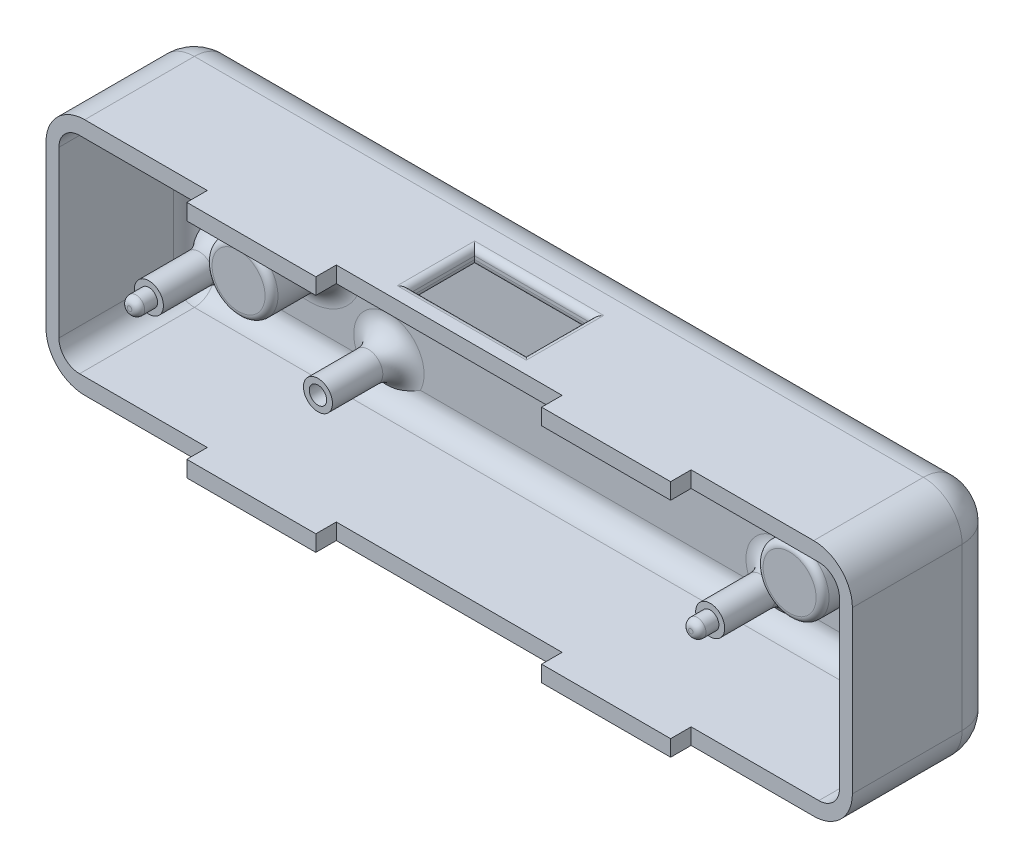
from build123d import *

# Parameters (mm, degrees)
SKETCH1_W           = 125
SKETCH1_H           = 37
BOSS_EXTRUDE1_DEPTH = 2
SKETCH2_W           = 121
SKETCH2_H           = 32
BOSS_EXTRUDE2_DEPTH = 21
SKETCH5_R           = 5.109529215
BOSS_EXTRUDE4_DEPTH = 11
SKETCH6_R           = 1.35
BOSS_EXTRUDE5_DEPTH = 14
SKETCH7_R           = 2.25
BOSS_EXTRUDE6_DEPTH = 11
CUT_EXTRUDE1_REACH  = 78.186
SKETCH9_W           = 18
SKETCH9_H           = 10
CUT_EXTRUDE2_START  = -12
SKETCH10_R          = 1.35
CUT_EXTRUDE2_DEPTH  = 12
FILLET1_R           = 3.2
FILLET2_R           = 1
FILLET3_R           = 6
SKETCH11_W          = 20
SKETCH11_H          = 2.5
BOSS_EXTRUDE7_DEPTH = 3.175


with BuildPart() as part:
    # Sketch1 → Boss-Extrude1 (new body)
    with BuildSketch(Plane.XY):
        Rectangle(SKETCH1_W, SKETCH1_H)
    extrude(amount=BOSS_EXTRUDE1_DEPTH)

    # Sketch2 → Boss-Extrude2 (add)
    with BuildSketch(Plane.XY.offset(2)):
        Polygon((60.5, -18.5), (-60.5, -18.5), (-62.5, -18.5), (-62.5, 18.5), (-60.5, 18.5), (60.5, 18.5), (62.5, 18.5), (62.5, -18.5), align=None)
        Rectangle(SKETCH2_W, SKETCH2_H, mode=Mode.SUBTRACT)
    extrude(amount=BOSS_EXTRUDE2_DEPTH)

    # Sketch5 → Boss-Extrude4 (add)
    with BuildSketch(Plane.XY.offset(2)):
        with Locations(Location((-42.6527, -1.2074, 0), (0, 0, 180))):
            Circle(SKETCH5_R)
        with Locations(Location((42.7653, 1, 0), (0, 0, 180))):
            Circle(SKETCH5_R)
    extrude(amount=BOSS_EXTRUDE4_DEPTH)

    # Sketch6 → Boss-Extrude5 (add)
    with BuildSketch(Plane.XY.offset(2)):
        with Locations(Location((-30.3427, 9.9726, 0), (0, 0, 180))):
            Circle(SKETCH6_R)
        with Locations(Location((-56.5527, 9.9726, 0), (0, 0, 180))):
            Circle(SKETCH6_R)
        with Locations(Location((-56.5527, -10.3874, 0), (0, 0, 180))):
            Circle(SKETCH6_R)
        with Locations(Location((-30.3427, -10.3874, 0), (0, 0, 180))):
            Circle(SKETCH6_R)
        with Locations(Location((56.6653, 10.18, 0), (0, 0, 180))):
            Circle(SKETCH6_R)
        with Locations(Location((30.4553, 10.18, 0), (0, 0, 180))):
            Circle(SKETCH6_R)
        with Locations(Location((30.4553, -10.18, 0), (0, 0, 180))):
            Circle(SKETCH6_R)
        with Locations(Location((56.6653, -10.18, 0), (0, 0, 180))):
            Circle(SKETCH6_R)
    extrude(amount=BOSS_EXTRUDE5_DEPTH)

    # Sketch7 → Boss-Extrude6 (add)
    with BuildSketch(Plane.XY.offset(2)):
        with Locations(Location((56.6653, -10.18, 0), (0, 0, 180))):
            Circle(SKETCH7_R)
        with Locations(Location((30.4553, -10.18, 0), (0, 0, 180))):
            Circle(SKETCH7_R)
        with Locations(Location((30.4553, 10.18, 0), (0, 0, 180))):
            Circle(SKETCH7_R)
        with Locations(Location((56.6653, 10.18, 0), (0, 0, 180))):
            Circle(SKETCH7_R)
        with Locations(Location((-30.3427, 9.9726, 0), (0, 0, 180))):
            Circle(SKETCH7_R)
        with Locations(Location((-30.3427, -10.3874, 0), (0, 0, 180))):
            Circle(SKETCH7_R)
        with Locations(Location((-56.5527, -10.3874, 0), (0, 0, 180))):
            Circle(SKETCH7_R)
        with Locations(Location((-56.5527, 9.9726, 0), (0, 0, 180))):
            Circle(SKETCH7_R)
    extrude(amount=BOSS_EXTRUDE6_DEPTH)

    # Sketch9 → Cut-Extrude1 (cut, up to next)
    with BuildSketch(Plane(origin=(0, 18.5, 0), x_dir=(1, 0, 0), z_dir=(0, 1, 0)), mode=Mode.PRIVATE) as cut_extrude1_sk1:
        with Locations((0, -15.053877106)):
            Rectangle(SKETCH9_W, SKETCH9_H)
    cut_extrude1_tool1 = extrude(cut_extrude1_sk1.sketch, amount=-CUT_EXTRUDE1_REACH, mode=Mode.PRIVATE) & part.part
    add(cut_extrude1_tool1.solids().sort_by_distance((0, 18.5, 15.053877))[0], mode=Mode.SUBTRACT)

    # Sketch10 → Cut-Extrude2 (cut)
    with BuildSketch(Plane.XY.offset(16).offset(CUT_EXTRUDE2_START)):
        with Locations((30.4553, 10.18)):
            Circle(SKETCH10_R)
        with Locations((-30.3427, -10.3874)):
            Circle(SKETCH10_R)
    extrude(amount=CUT_EXTRUDE2_DEPTH, mode=Mode.SUBTRACT)

    # Fillet1
    # the kernel refuses this fillet: 3.2 mm, written as the material it adds along each edge
    with BuildSketch(Plane(origin=(-57.3, -12.8, 5.2), x_dir=(0, -1, 0), z_dir=(-1, 0, 0))) as fillet1_piece_1_section:
        Polygon((0, 0), (FILLET1_R, 0), (FILLET1_R, -FILLET1_R), (0, -FILLET1_R), align=None)
    fillet1_piece_1 = extrude(amount=FILLET1_R, mode=Mode.PRIVATE)
    fillet1_piece_1 = fillet1_piece_1 - Plane(origin=(-57.3, -12.8, 5.2), x_dir=(0, 0.7071067811865475, 0.7071067811865475), z_dir=(-1, 0, 0)) * Sphere(FILLET1_R, mode=Mode.PRIVATE)
    add(fillet1_piece_1)
    with BuildSketch(Plane(origin=(-57.3, 12.8, 5.2), x_dir=(0, 1, 0), z_dir=(-1, 0, 0))) as fillet1_piece_2_section:
        Polygon((0, 0), (FILLET1_R, 0), (FILLET1_R, FILLET1_R), (0, FILLET1_R), align=None)
    fillet1_piece_2 = extrude(amount=FILLET1_R, mode=Mode.PRIVATE)
    fillet1_piece_2 = fillet1_piece_2 - Plane(origin=(-57.3, 12.8, 5.2), x_dir=(0, -0.7071067811865475, 0.7071067811865475), z_dir=(-1, 0, 0)) * Sphere(FILLET1_R, mode=Mode.PRIVATE)
    add(fillet1_piece_2)
    with BuildSketch(Plane(origin=(57.3, -12.8, 5.2), x_dir=(0, -1, 0), z_dir=(1, 0, 0))) as fillet1_piece_3_section:
        Polygon((0, 0), (FILLET1_R, 0), (FILLET1_R, FILLET1_R), (0, FILLET1_R), align=None)
    fillet1_piece_3 = extrude(amount=FILLET1_R, mode=Mode.PRIVATE)
    fillet1_piece_3 = fillet1_piece_3 - Plane(origin=(57.3, -12.8, 5.2), x_dir=(0, 0.7071067811865475, 0.7071067811865475), z_dir=(1, 0, 0)) * Sphere(FILLET1_R, mode=Mode.PRIVATE)
    add(fillet1_piece_3)
    with BuildSketch(Plane(origin=(57.3, 12.8, 5.2), x_dir=(1, 0, 0), z_dir=(0, 1, 0))) as fillet1_piece_4_section:
        Polygon((0, 0), (FILLET1_R, 0), (FILLET1_R, FILLET1_R), (0, FILLET1_R), align=None)
    fillet1_piece_4 = extrude(amount=FILLET1_R, mode=Mode.PRIVATE)
    fillet1_piece_4 = fillet1_piece_4 - Plane(origin=(57.3, 12.8, 5.2), x_dir=(-0.7071067811865475, 0, 0.7071067811865475), z_dir=(0, 1, 0)) * Sphere(FILLET1_R, mode=Mode.PRIVATE)
    add(fillet1_piece_4)
    with BuildSketch(Plane(origin=(-30.3427, 9.9726, 2), x_dir=(-1, 0, 0), z_dir=(0, 1, 0))) as fillet1_piece_5:
        with BuildLine():
            CenterArc((2.25 + FILLET1_R, FILLET1_R), FILLET1_R, 180, 90)
            Line((2.25, FILLET1_R), (2.25, 0))
            Line((2.25, 0), (2.25 + FILLET1_R, 0))
        make_face()
    revolve(axis=Axis((-30.3427, 9.9726, 2), (0, 0, 1)))
    with BuildSketch(Plane(origin=(-30.3427, -10.3874, 2), x_dir=(-1, 0, 0), z_dir=(0, 1, 0))) as fillet1_piece_6:
        with BuildLine():
            CenterArc((2.25 + FILLET1_R, FILLET1_R), FILLET1_R, 180, 90)
            Line((2.25, FILLET1_R), (2.25, 0))
            Line((2.25, 0), (2.25 + FILLET1_R, 0))
        make_face()
    revolve(axis=Axis((-30.3427, -10.3874, 2), (0, 0, 1)))
    with BuildSketch(Plane(origin=(-56.5527, -10.3874, 2), x_dir=(-1, 0, 0), z_dir=(0, 1, 0))) as fillet1_piece_7:
        with BuildLine():
            CenterArc((2.25 + FILLET1_R, FILLET1_R), FILLET1_R, 180, 90)
            Line((2.25, FILLET1_R), (2.25, 0))
            Line((2.25, 0), (2.25 + FILLET1_R, 0))
        make_face()
    revolve(axis=Axis((-56.5527, -10.3874, 2), (0, 0, 1)))
    with BuildSketch(Plane(origin=(-56.5527, 9.9726, 2), x_dir=(-1, 0, 0), z_dir=(0, 1, 0))) as fillet1_piece_8:
        with BuildLine():
            CenterArc((2.25 + FILLET1_R, FILLET1_R), FILLET1_R, 180, 90)
            Line((2.25, FILLET1_R), (2.25, 0))
            Line((2.25, 0), (2.25 + FILLET1_R, 0))
        make_face()
    revolve(axis=Axis((-56.5527, 9.9726, 2), (0, 0, 1)))
    with BuildSketch(Plane(origin=(-60.5, -12.8, 2), x_dir=(1, 0, 0), z_dir=(0, 1, 0))) as fillet1_piece_9:
        with BuildLine():
            CenterArc((FILLET1_R, -FILLET1_R), FILLET1_R, 90, 90)
            Line((0, -FILLET1_R), (0, 0))
            Line((0, 0), (FILLET1_R, 0))
        make_face()
    extrude(amount=25.6)
    with BuildSketch(Plane(origin=(57.3, -16, 2), x_dir=(0, 0, 1), z_dir=(-1, 0, 0)), Plane(origin=(-57.3, 16, 2), x_dir=(0, 0, 1), z_dir=(1, 0, 0))) as fillet1_piece_10:
        with BuildLine():
            CenterArc((FILLET1_R, FILLET1_R), FILLET1_R, 180, 90)
            Line((0, FILLET1_R), (0, 0))
            Line((0, 0), (FILLET1_R, 0))
        make_face()
    extrude(amount=114.6)
    with BuildSketch(Plane(origin=(60.5, 12.8, 2), x_dir=(0, 0, 1), z_dir=(0, -1, 0))) as fillet1_piece_11:
        with BuildLine():
            CenterArc((FILLET1_R, FILLET1_R), FILLET1_R, 180, 90)
            Line((0, FILLET1_R), (0, 0))
            Line((0, 0), (FILLET1_R, 0))
        make_face()
    extrude(amount=25.6)
    with BuildSketch(Plane(origin=(60.5, -16, 5.2), x_dir=(0, 1, 0), z_dir=(0, 0, 1)), Plane(origin=(60.5, 16, 5.2), x_dir=(-1, 0, 0), z_dir=(0, 0, 1)), Plane(origin=(-60.5, -16, 5.2), x_dir=(1, 0, 0), z_dir=(0, 0, 1))) as fillet1_piece_12:
        with BuildLine():
            CenterArc((FILLET1_R, FILLET1_R), FILLET1_R, 180, 90)
            Line((0, FILLET1_R), (0, 0))
            Line((0, 0), (FILLET1_R, 0))
        make_face()
    extrude(amount=17.8)
    with BuildSketch(Plane(origin=(-60.5, 16, 5.2), x_dir=(1, 0, 0), z_dir=(0, 0, 1))) as fillet1_piece_13:
        with BuildLine():
            CenterArc((FILLET1_R, -FILLET1_R), FILLET1_R, 90, 90)
            Line((0, -FILLET1_R), (0, 0))
            Line((0, 0), (FILLET1_R, 0))
        make_face()
    extrude(amount=17.8)
    with BuildSketch(Plane(origin=(-42.6527, -1.2074, 2), x_dir=(-1, 0, 0), z_dir=(0, 1, 0))) as fillet1_piece_14:
        with BuildLine():
            CenterArc((5.109529215 + FILLET1_R, FILLET1_R), FILLET1_R, 180, 90)
            Line((5.109529215, FILLET1_R), (5.109529215, 0))
            Line((5.109529215, 0), (5.109529215 + FILLET1_R, 0))
        make_face()
    revolve(axis=Axis((-42.6527, -1.2074, 2), (0, 0, 1)))
    with BuildSketch(Plane(origin=(42.7653, 1, 2), x_dir=(-1, 0, 0), z_dir=(0, 1, 0))) as fillet1_piece_15:
        with BuildLine():
            CenterArc((5.109529215 + FILLET1_R, FILLET1_R), FILLET1_R, 180, 90)
            Line((5.109529215, FILLET1_R), (5.109529215, 0))
            Line((5.109529215, 0), (5.109529215 + FILLET1_R, 0))
        make_face()
    revolve(axis=Axis((42.7653, 1, 2), (0, 0, 1)))
    with BuildSketch(Plane(origin=(56.6653, -10.18, 2), x_dir=(-1, 0, 0), z_dir=(0, 1, 0))) as fillet1_piece_16:
        with BuildLine():
            CenterArc((2.25 + FILLET1_R, FILLET1_R), FILLET1_R, 180, 90)
            Line((2.25, FILLET1_R), (2.25, 0))
            Line((2.25, 0), (2.25 + FILLET1_R, 0))
        make_face()
    revolve(axis=Axis((56.6653, -10.18, 2), (0, 0, 1)))
    with BuildSketch(Plane(origin=(30.4553, -10.18, 2), x_dir=(-1, 0, 0), z_dir=(0, 1, 0))) as fillet1_piece_17:
        with BuildLine():
            CenterArc((2.25 + FILLET1_R, FILLET1_R), FILLET1_R, 180, 90)
            Line((2.25, FILLET1_R), (2.25, 0))
            Line((2.25, 0), (2.25 + FILLET1_R, 0))
        make_face()
    revolve(axis=Axis((30.4553, -10.18, 2), (0, 0, 1)))
    with BuildSketch(Plane(origin=(30.4553, 10.18, 2), x_dir=(-1, 0, 0), z_dir=(0, 1, 0))) as fillet1_piece_18:
        with BuildLine():
            CenterArc((2.25 + FILLET1_R, FILLET1_R), FILLET1_R, 180, 90)
            Line((2.25, FILLET1_R), (2.25, 0))
            Line((2.25, 0), (2.25 + FILLET1_R, 0))
        make_face()
    revolve(axis=Axis((30.4553, 10.18, 2), (0, 0, 1)))
    with BuildSketch(Plane(origin=(56.6653, 10.18, 2), x_dir=(-1, 0, 0), z_dir=(0, 1, 0))) as fillet1_piece_19:
        with BuildLine():
            CenterArc((2.25 + FILLET1_R, FILLET1_R), FILLET1_R, 180, 90)
            Line((2.25, FILLET1_R), (2.25, 0))
            Line((2.25, 0), (2.25 + FILLET1_R, 0))
        make_face()
    revolve(axis=Axis((56.6653, 10.18, 2), (0, 0, 1)))

    # Fillet2
    fillet2_edges = [part.edges().sort_by_distance(p)[0] for p in [
        (-9, 18.5, 15.053877106),
        (0, 18.5, 20.053877106),
        (9, 18.5, 15.053877106),
        (0, 18.5, 10.053877106),
        (0, 16, 20.053877106),
        (9, 16, 15.053877106),
        (0, 16, 10.053877106),
        (-9, 16, 15.053877106),
        (-37.543170785, -1.2074, 13),
        (47.874829215, 1, 13),
        (-28.9927, 9.9726, 16),
        (-55.2027, 9.9726, 16),
        (-55.2027, -10.3874, 16),
        (58.0153, 10.18, 16),
        (31.8053, -10.18, 16),
        (58.0153, -10.18, 16),
    ]]
    fillet(fillet2_edges, radius=FILLET2_R)

    # Fillet3
    fillet3_edges = [part.edges().sort_by_distance(p)[0] for p in [
        (0, -18.5, 0),
        (62.5, 0, 0),
        (0, 18.5, 0),
        (-62.5, 0, 0),
        (-62.5, -18.5, 11.5),
        (62.5, -18.5, 11.5),
        (62.5, 18.5, 11.5),
        (-62.5, 18.5, 11.5),
    ]]
    fillet(fillet3_edges, radius=FILLET3_R)

    # Sketch11 → Boss-Extrude7 (add)
    with BuildSketch(Plane.XY.offset(23)):
        with Locations((-27.5, 17.25)):
            Rectangle(SKETCH11_W, SKETCH11_H)
        with Locations((-27.5, -17.25)):
            Rectangle(SKETCH11_W, SKETCH11_H)
        with Locations((27.5, 17.25)):
            Rectangle(SKETCH11_W, SKETCH11_H)
        with Locations((27.5, -17.25)):
            Rectangle(SKETCH11_W, SKETCH11_H)
    extrude(amount=BOSS_EXTRUDE7_DEPTH)


solid = part.part
